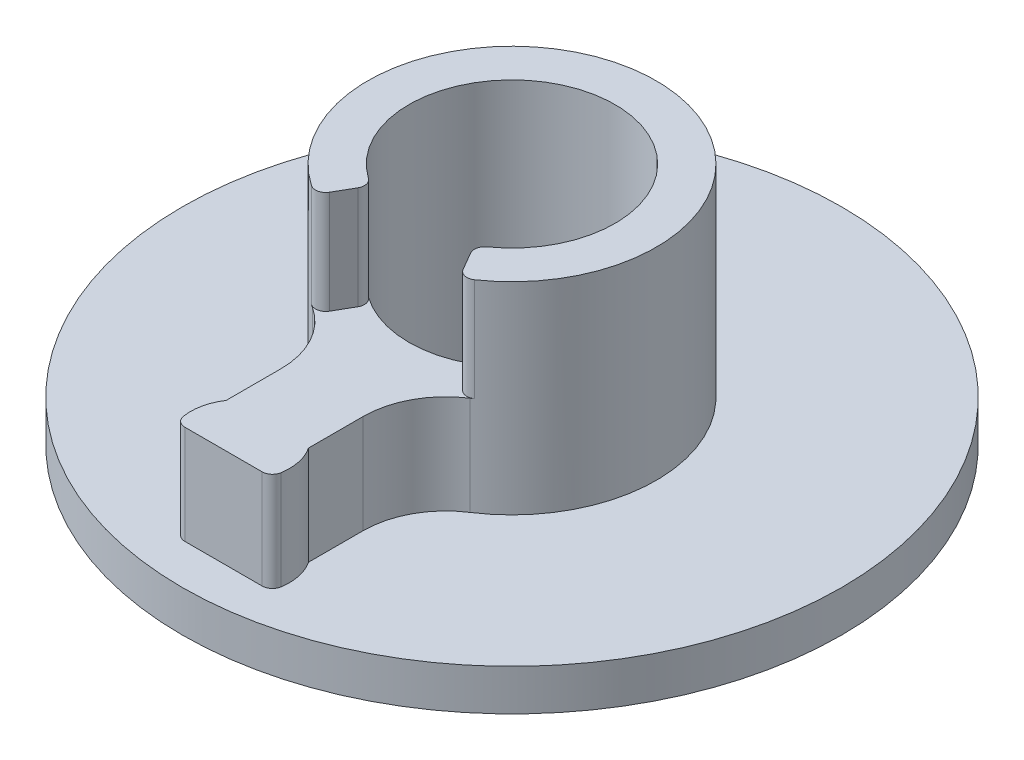
from build123d import *

# Parameters (mm, degrees)
ESQUISSE1_R             = 8
ESQUISSE1_R_2           = 2.5
BOSS_EXTRU_1_DEPTH      = 1
ESQUISSE2_R             = 2.5
BOSS_EXTRU_2_DEPTH      = 4.9
ESQUISSE4_R             = 5.4
ESQUISSE4_R_2           = 4
BOSS_EXTRU_3_DEPTH      = 1.5
ENL_V_START             = -2.5
ENL_V_MAT_EXTRU_3_DEPTH = 2.5
CONG_4_R                = 0.25
ESQUISSE6_R             = 3.25
ESQUISSE6_R_2           = 2.25
BOSS_EXTRU_4_DEPTH      = 1.4
CHANFREIN1_SIZE         = 0.2
CHANFREIN1_SIZE2        = 0.115470054


with BuildPart() as part:
    # Esquisse1 → Boss.-Extru.1 (new body)
    with BuildSketch(Plane(origin=(0, 0, 0), x_dir=(1, 0, 0), z_dir=(0, 1, 0))):
        with Locations(Location((0, 0, 0), (0, 0, 270))):
            Circle(ESQUISSE1_R)
        with Locations(Location((0, 0, 0), (0, 0, 270))):
            Circle(ESQUISSE1_R_2, mode=Mode.SUBTRACT)
    extrude(amount=BOSS_EXTRU_1_DEPTH)

    # Esquisse2 → Boss.-Extru.2 (add)
    with BuildSketch(Plane(origin=(0, 1, 0), x_dir=(1, 0, 0), z_dir=(0, 1, 0))):
        with BuildLine():
            Line((-1, -5.936675042), (-1, -4.609772229))
            ThreePointArc((-1, -4.609772229), (-1.241901854, -3.656309639), (-1.909090909, -2.933491418))
            ThreePointArc((-1.909090909, -2.933491418), (0, 3.5), (1.909090909, -2.933491418))
            ThreePointArc((1.909090909, -2.933491418), (1.241901854, -3.656309639), (1, -4.609772229))
            Line((1, -4.609772229), (1, -5.936675042))
            ThreePointArc((1, -5.936675042), (1.190945178, -6.452862026), (1.13137085, -7))
            Line((1.13137085, -7), (-1.13137085, -7))
            ThreePointArc((-1.13137085, -7), (-1.190945178, -6.452862026), (-1, -5.936675042))
        make_face()
        with Locations(Location((0, 0, 0), (0, 0, 270))):
            Circle(ESQUISSE2_R, mode=Mode.SUBTRACT)
    extrude(amount=BOSS_EXTRU_2_DEPTH)

    # Esquisse4 → Boss.-Extru.3 (add)
    with BuildSketch(Plane.XZ):
        with Locations(Location((0, 0, 0), (0, 0, 90))):
            Circle(ESQUISSE4_R)
        with Locations(Location((0, 0, 0), (0, 0, 270))):
            Circle(ESQUISSE4_R_2, mode=Mode.SUBTRACT)
    extrude(amount=BOSS_EXTRU_3_DEPTH)

    # Esquisse5 → Enlèv. mat.-Extru.3 (cut)
    with BuildSketch(Plane(origin=(0, 5.9, 0), x_dir=(1, 0, 0), z_dir=(0, 1, 0)).offset(ENL_V_START)):
        with BuildLine():
            Line((-1.25, -2.165063509), (-1.756893339, -3.043028526))
            ThreePointArc((-1.756893339, -3.043028526), (-1.199137245, -3.739776057), (-1, -4.609772229))
            Line((-1, -4.609772229), (-1, -5.936675042))
            ThreePointArc((-1, -5.936675042), (-1.190945178, -6.452862026), (-1.13137085, -7))
            Line((-1.13137085, -7), (1.13137085, -7))
            ThreePointArc((1.13137085, -7), (1.190945178, -6.452862026), (1, -5.936675042))
            Line((1, -5.936675042), (1, -4.609772229))
            ThreePointArc((1, -4.609772229), (1.199137245, -3.739776057), (1.756893339, -3.043028526))
            Line((1.756893339, -3.043028526), (1.25, -2.165063509))
            ThreePointArc((1.25, -2.165063509), (0, -2.5), (-1.25, -2.165063509))
        make_face()
    extrude(amount=ENL_V_MAT_EXTRU_3_DEPTH, mode=Mode.SUBTRACT)

    # Congé4
    # the kernel refuses this fillet: 0.25 mm, written as the material it takes off along each edge
    with BuildSketch(Plane(origin=(-1.756893339, 3.4, 3.043028526), x_dir=(-0.8178765908419041, 0, -0.5753936758019024), z_dir=(0, 1, 0))) as cong_4_piece_1:
        with BuildLine():
            CenterArc((0.27343415, -0.249980508), CONG_4_R, 90.715480429, 94.411725785)
            Line((0.024434464, -0.272322319), (-0.000465505, -0.2745565))
            Line((-0.000465505, -0.2745565), (-0.024899969, -0.002234181))
            Line((-0.024899969, -0.002234181), (0.001440168, 0.024958484))
            ThreePointArc((0.001440168, 0.024958484), (0.186602135, 0.022969346), (0.270000179, 0.024998051))
            Line((0.270000179, 0.024998051), (0.270312359, 0))
        make_face()
    extrude(amount=3.183540821, mode=Mode.SUBTRACT)
    with BuildSketch(Plane(origin=(-1.25, 3.4, 2.165063509), x_dir=(-0.5000000000000009, 0, 0.866025403784438), z_dir=(0, 1, 0))) as cong_4_piece_2:
        with BuildLine():
            CenterArc((0.238612788, -0.25), CONG_4_R, 90, 84.78409143)
            ThreePointArc((-0.010352011, -0.227272727), (-0.002589344, -0.113754183), (0, 0))
            Line((0, 0), (0.238612788, 0))
        make_face()
    extrude(amount=3.096531969, mode=Mode.SUBTRACT)
    with BuildSketch(Plane(origin=(1.25, 3.4, 2.165063509), x_dir=(0.5000000000000017, 0, 0.8660254037844376), z_dir=(0, 1, 0))) as cong_4_piece_3:
        with BuildLine():
            CenterArc((0.238612788, 0.25), CONG_4_R, 185.21590857, 84.78409143)
            ThreePointArc((-0.010352011, 0.227272727), (-0.002589344, 0.113754183), (0, 0))
            Line((0, 0), (0.238612788, 0))
        make_face()
    extrude(amount=3.096531969, mode=Mode.SUBTRACT)
    with BuildSketch(Plane(origin=(1.756893339, 3.4, 3.043028526), x_dir=(0.817876590841908, 0, -0.5753936758018968), z_dir=(0, 1, 0))) as cong_4_piece_4:
        with BuildLine():
            CenterArc((0.27343415, 0.249980508), CONG_4_R, 174.872793786, 94.411725785)
            Line((0.024434464, 0.272322319), (-0.000465505, 0.2745565))
            Line((-0.000465505, 0.2745565), (-0.024899969, 0.002234181))
            Line((-0.024899969, 0.002234181), (0.001440168, -0.024958484))
            ThreePointArc((0.001440168, -0.024958484), (0.186602135, -0.022969346), (0.270000179, -0.024998051))
            Line((0.270000179, -0.024998051), (0.270312359, 0))
        make_face()
    extrude(amount=3.183540821, mode=Mode.SUBTRACT)
    with BuildSketch(Plane(origin=(-1.13137085, 1, 7), x_dir=(1, 0, 0), z_dir=(0, 1, 0))) as cong_4_piece_5:
        with BuildLine():
            CenterArc((0.193287698, 0.25), CONG_4_R, 189.084720287, 80.915279713)
            ThreePointArc((-0.053576289, 0.210526316), (-0.031561904, 0.104048297), (0, 0))
            Line((0, 0), (0.193287698, 0))
        make_face()
    extrude(amount=2.943091546, mode=Mode.SUBTRACT)
    with BuildSketch(Plane(origin=(1.13137085, 1, 7), x_dir=(-1, 0, 0), z_dir=(0, 1, 0))) as cong_4_piece_6:
        with BuildLine():
            CenterArc((0.193287698, -0.25), CONG_4_R, 90, 80.915279713)
            ThreePointArc((-0.053576289, -0.210526316), (-0.031561904, -0.104048297), (0, 0))
            Line((0, 0), (0.193287698, 0))
        make_face()
    extrude(amount=2.943091546, mode=Mode.SUBTRACT)

    # Chanfrein1
    chanfrein1_edges = [part.edges().sort_by_distance(p)[0] for p in [
        (0, -1.5, -5.4),
    ]]
    chanfrein1_side = [part.faces().sort_by_distance(p)[0] for p in [
        (0, -0.75, -5.4),
    ]]
    chamfer(chanfrein1_edges, length=CHANFREIN1_SIZE, length2=CHANFREIN1_SIZE2, reference=chanfrein1_side[0])


with BuildPart() as body_2:
    # Esquisse6 → Boss.-Extru.4 (new body)
    with BuildSketch(Plane.XZ.offset(1.5)):
        with Locations(Location((0, 0, 0), (0, 0, 270))):
            Circle(ESQUISSE6_R)
        with Locations(Location((0, 0, 0), (0, 0, 270))):
            Circle(ESQUISSE6_R_2, mode=Mode.SUBTRACT)
    extrude(amount=-BOSS_EXTRU_4_DEPTH)


solid = Compound([part.part, body_2.part])
